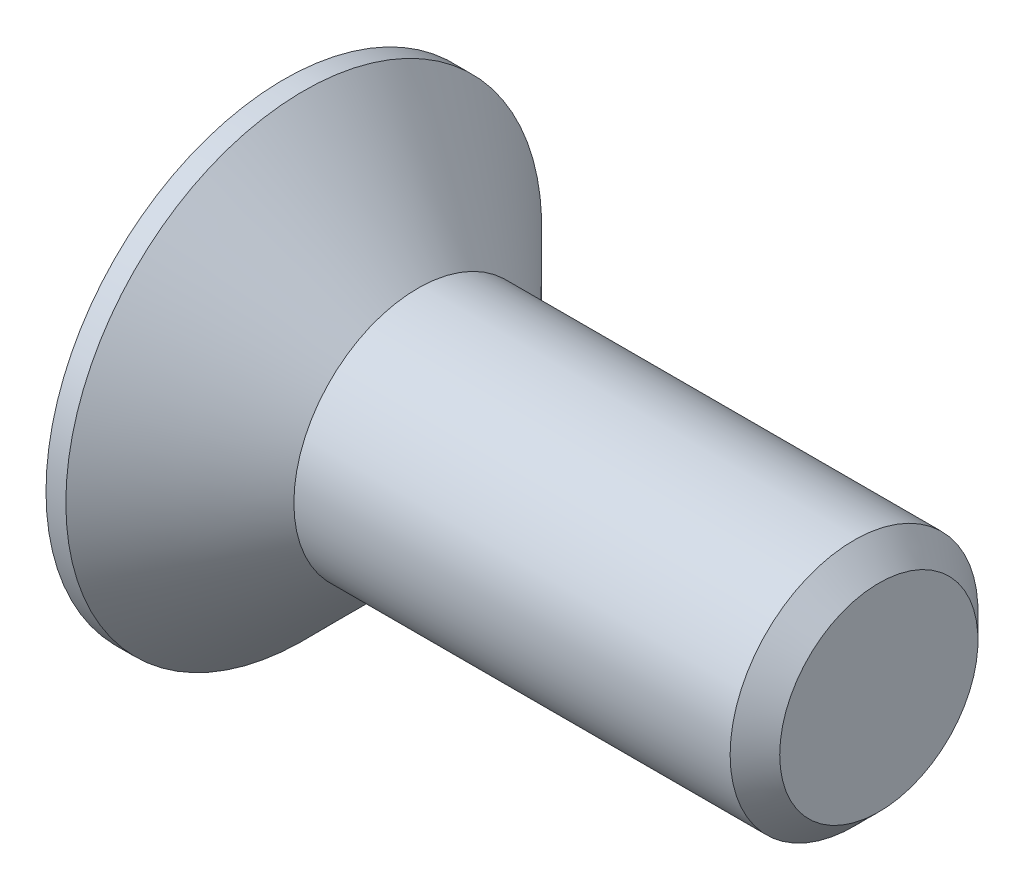
from build123d import *

# Parameters (mm, degrees)
CUT_EXTRUDE1_DEPTH = 0.8


with BuildPart() as part:
    # Sketch2 → Revolve1 (revolve)
    with BuildSketch(Plane.XY):
        Polygon((0, 0), (0, 2.4), (0.2, 2.4), (1.35, 1.25), (5.75, 1.25), (6, 1), (6, 0), align=None)
    revolve(axis=Axis((-2.281841559, 0, 0), (1, 0, 0)))

    # Sketch3 → Cut-Extrude1 (cut)
    with BuildSketch(Plane.ZY):
        Polygon((0.433012702, -0.75), (0.866025404, 0), (0.433012702, 0.75), (-0.433012702, 0.75), (-0.866025404, 0), (-0.433012702, -0.75), align=None)
    extrude(amount=-CUT_EXTRUDE1_DEPTH, mode=Mode.SUBTRACT)


solid = part.part
